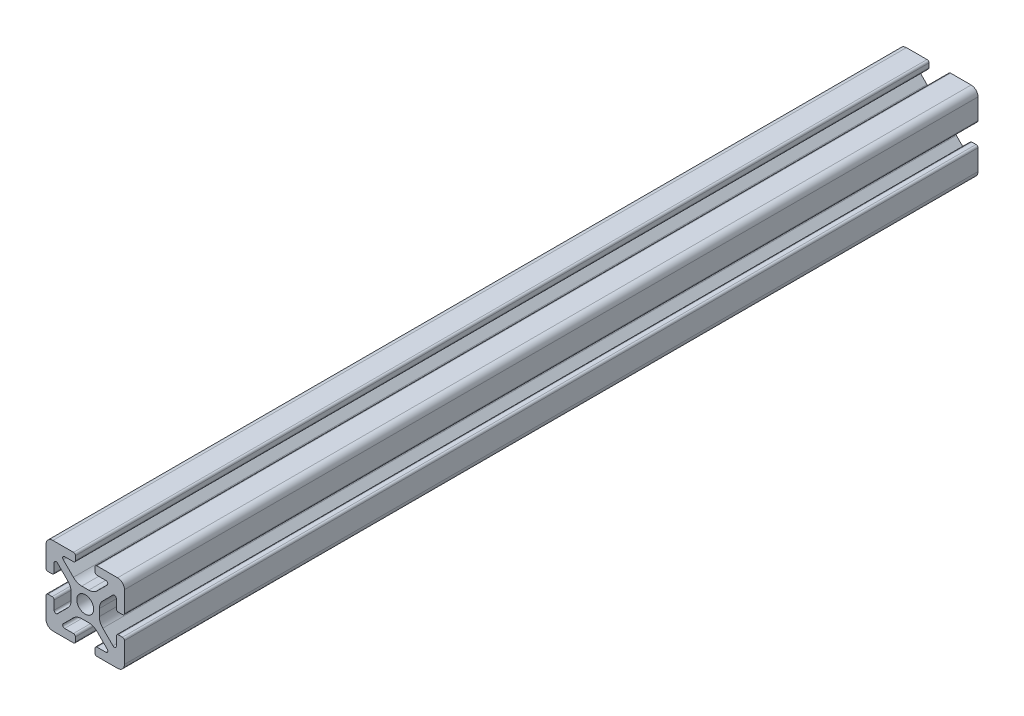
from build123d import *

# Parameters (mm, degrees)
BOSS_EXTRUDE1_DEPTH = 110
SKETCH5_W           = 27.787302718
SKETCH5_H           = 26.03929452
CUT_EXTRUDE1_DEPTH  = 2.4


with BuildPart() as part:
    # Sketch4 → Boss-Extrude1 (new, symmetric)
    with BuildSketch(Plane.XY):
        with BuildLine():
            Line((3, -10), (8.25, -10))
            ThreePointArc((8.25, -10), (9.487436867, -9.487436867), (10, -8.25))
            Line((10, -8.25), (10, -3))
            ThreePointArc((10, -3), (9.853553391, -2.646446609), (9.5, -2.5))
            Line((9.5, -2.5), (8.424621202, -2.5))
            ThreePointArc((8.424621202, -2.5), (8.071067812, -2.646446609), (7.924621202, -3))
            Line((7.924621202, -3), (7.924621202, -5.25))
            ThreePointArc((7.924621202, -5.25), (7.615962919, -5.711939766), (7.071067812, -5.603553391))
            Line((7.071067812, -5.603553391), (4.478679656, -3.011165235))
            ThreePointArc((4.478679656, -3.011165235), (3.828361402, -2.037895189), (3.6, -0.889844892))
            Line((3.6, -0.889844892), (3.6, 0))
            Line((3.6, 0), (2.15, 0))
            ThreePointArc((2.15, 0), (1.52027958, -1.52027958), (0, -2.15))
            Line((0, -2.15), (0, -3.6))
            Line((0, -3.6), (0.889844892, -3.6))
            ThreePointArc((0.889844892, -3.6), (2.037895189, -3.828361402), (3.011165235, -4.478679656))
            Line((3.011165235, -4.478679656), (5.603553391, -7.071067812))
            ThreePointArc((5.603553391, -7.071067812), (5.711939766, -7.615962919), (5.25, -7.924621202))
            Line((5.25, -7.924621202), (3, -7.924621202))
            ThreePointArc((3, -7.924621202), (2.646446609, -8.071067812), (2.5, -8.424621202))
            Line((2.5, -8.424621202), (2.5, -9.5))
            ThreePointArc((2.5, -9.5), (2.646446609, -9.853553391), (3, -10))
        make_face()
    extrude(amount=BOSS_EXTRUDE1_DEPTH, both=True)

    # Mirror1: part across plane


with BuildPart() as part_1:
    add(part.part)
    add(part.part.mirror(Plane(origin=(0, 0, 0), x_dir=(0, 0, 1), z_dir=(1, 0, 0))))

    # Mirror2: part across plane


with BuildPart() as part_2:
    add(part_1.part)
    add(part_1.part.mirror(Plane.ZX))

    # Sketch5 → Cut-Extrude1 (cut)
    with BuildSketch(Plane.XY.offset(110)):
        with Locations((-0.060276145, -0.663037592)):
            Rectangle(SKETCH5_W, SKETCH5_H)
    extrude(amount=-CUT_EXTRUDE1_DEPTH, mode=Mode.SUBTRACT)


solid = part_2.part
